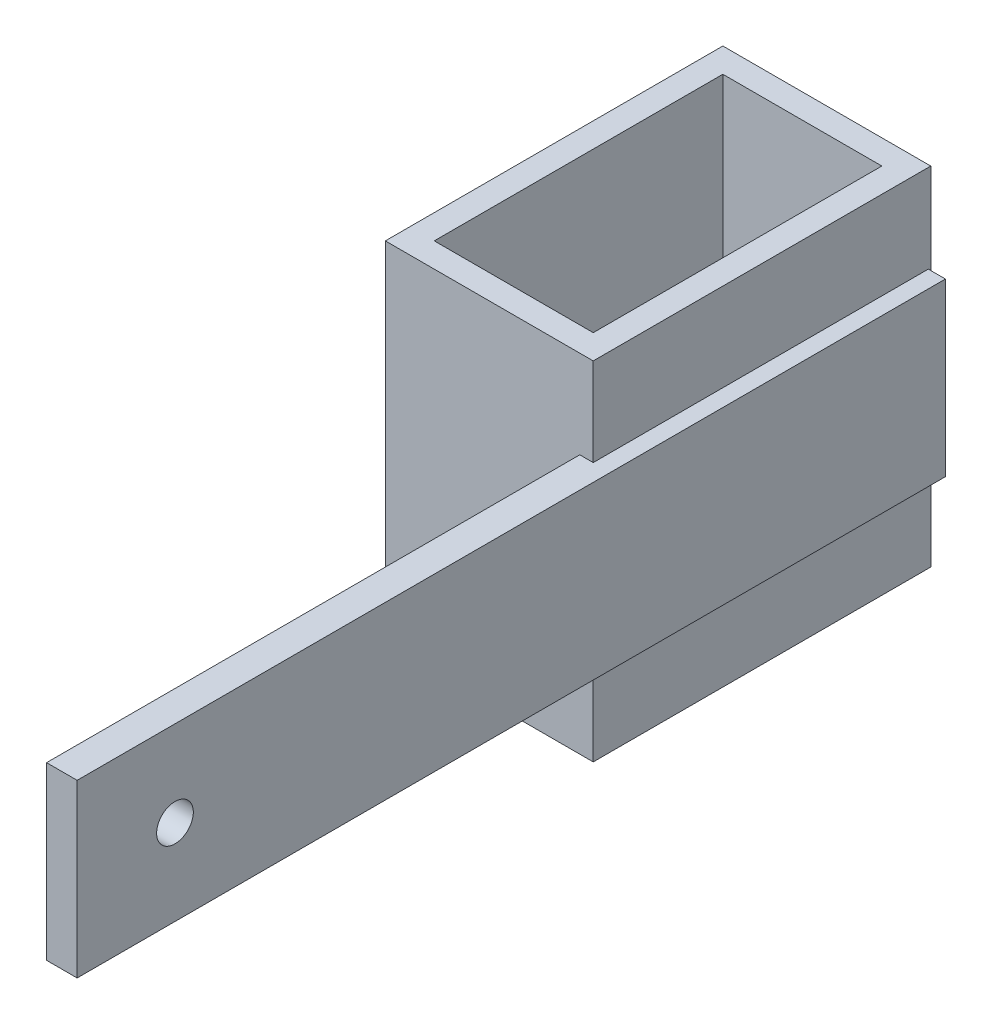
from build123d import *

# Parameters (mm, degrees)
S_BOX1_W       = 2.5
S_BOX1_H       = 14
BOSS_1_DEPTH   = 71
S_BOX2_W       = 17
S_BOX2_H       = 28.4
BOSS_2_DEPTH   = 27.6
S_CUT3_W       = 13
S_CUT3_H       = 28.6
POCKET_3_DEPTH = 23.6
S_HOLE4_R      = 1.5
HOLE_4_DEPTH   = 2.7


with BuildPart() as part:
    # S_box1 → Boss_1 (new body)
    with BuildSketch(Plane.XY.offset(-63)):
        with Locations((16.65, 0)):
            Rectangle(S_BOX1_W, S_BOX1_H)
    extrude(amount=BOSS_1_DEPTH)

    # S_box2 → Boss_2 (add)
    with BuildSketch(Plane.XY.offset(-63.2)):
        with Locations((8, 0)):
            Rectangle(S_BOX2_W, S_BOX2_H)
    extrude(amount=BOSS_2_DEPTH)

    # S_cut3 → Pocket_3 (cut)
    with BuildSketch(Plane.XY.offset(-61.2)):
        with Locations((8, 0)):
            Rectangle(S_CUT3_W, S_CUT3_H)
    extrude(amount=POCKET_3_DEPTH, mode=Mode.SUBTRACT)

    # S_hole4 → Hole_4 (cut)
    with BuildSketch(Plane(origin=(15.3, 0, 0), x_dir=(0, 0, -1), z_dir=(1, 0, 0))):
        Circle(S_HOLE4_R)
    extrude(amount=HOLE_4_DEPTH, mode=Mode.SUBTRACT)


solid = part.part
